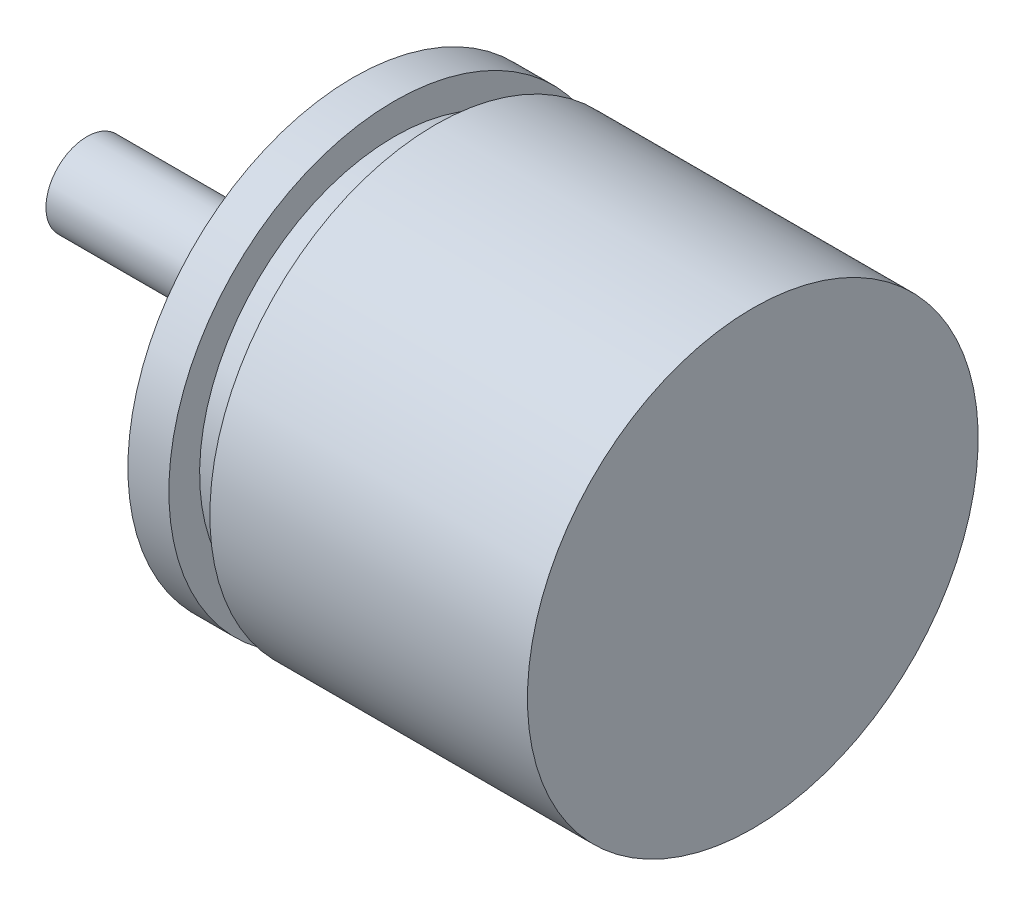
from build123d import *
from build123d.topology import SkipClean

# Parameters (mm, degrees)
CUT_EXTRUDE_START   = -10
CUT_EXTRUDE_1_DEPTH = 10
SKETCH_3_R          = 1
CUT_EXTRUDE_2_DEPTH = 5
THREAD_1_PITCH      = 0.4
THREAD_2_PITCH      = 0.4
THREAD_3_PITCH      = 0.4


with BuildPart() as part:
    # Sketch 1 → 旋转1 (revolve)
    with BuildSketch(Plane.XY):
        Polygon((-15.5, 11), (0, 11), (0, 0), (-32.5, 0), (-32.5, 2), (-20.5, 2), (-20.5, 4), (-19.5, 4), (-19.5, 11), (-17.5, 11), (-17.5, 9.5), (-15.5, 9.5), align=None)
    revolve(axis=Axis((12.953613798, 0, 0), (-1, 0, 0)))

    # Sketch 2 → 切除-拉伸1 (cut)
    with BuildSketch(Plane.ZY.offset(32.5).offset(CUT_EXTRUDE_START)):
        with BuildLine():
            Line((1.2, -1.6), (-1.2, -1.6))
            ThreePointArc((-1.2, -1.6), (0, -2), (1.2, -1.6))
        make_face()
    extrude(amount=CUT_EXTRUDE_1_DEPTH, mode=Mode.SUBTRACT)

    # Sketch 3 → 切除-拉伸2 (cut)
    with BuildSketch(Plane.ZY.offset(19.5)):
        with Locations(Location((-7.5, 0, 0), (0, 0, 270))):
            Circle(SKETCH_3_R)
        with Locations(Location((3.75, 6.495190528, 0), (0, 0, 270))):
            Circle(SKETCH_3_R)
        with Locations(Location((3.75, -6.495190528, 0), (0, 0, 270))):
            Circle(SKETCH_3_R)
    extrude(amount=-CUT_EXTRUDE_2_DEPTH, mode=Mode.SUBTRACT)

    # 螺纹线1: the profile of Sketch 1 2 profile screwed along a right-hand helix of 12.5 turns, 6 arcs to a turn; built about Z, then put on its axis
    with SkipClean():  # the faces are left unmerged after this step: merging them gives an invalid solid
        thread_1_z = Axis((0, 0, 0), (0, 0, 1))
        thread_1_corners = [(0.9997, 0, -0.000173205), (1.21650635, 0, 0.124999999), (1.21650635, 0, 0.174999999), (0.9997, 0, 0.300173204)]
        with BuildLine(mode=Mode.PRIVATE) as thread_1_profile:
            Line(thread_1_corners[0], thread_1_corners[1])
            Line(thread_1_corners[1], thread_1_corners[2])
            Line(thread_1_corners[2], thread_1_corners[3])
            Line(thread_1_corners[3], thread_1_corners[0])
        thread_1_cap = Face(thread_1_profile.wire())
        thread_1_turn_angles = [0, 30, 60, 90, 120, 150, 180, 210, 240, 270, 300, 330, 360]
        thread_1_turn_weights = [1, 0.8660254037844387, 1, 0.8660254037844387, 1, 0.8660254037844387, 1, 0.8660254037844387, 1, 0.8660254037844387, 1, 0.8660254037844387, 1]
        thread_1_turn_rails = [Edge.make_bspline([Vector(p[0], p[1], 0).rotate(thread_1_z, thread_1_turn_angles[k]) / thread_1_turn_weights[k] + Vector(0, 0, p[2] + THREAD_1_PITCH * thread_1_turn_angles[k] / 360) for k in range(13)], [0, 0, 0, 1, 1, 2, 2, 3, 3, 4, 4, 5, 5, 6, 6, 6], 2, thread_1_turn_weights) for p in thread_1_corners]
        thread_1_turn_sides = [Face.make_surface_from_curves(thread_1_turn_rails[p[0]], thread_1_turn_rails[p[1]]) for p in [(0, 1), (1, 2), (2, 3), (3, 0)]]
        thread_1_last_angles = [4320, 4350, 4380, 4410, 4440, 4470, 4500]
        thread_1_last_weights = [1, 0.8660254037844387, 1, 0.8660254037844387, 1, 0.8660254037844387, 1]
        thread_1_last_rails = [Edge.make_bspline([Vector(p[0], p[1], 0).rotate(thread_1_z, thread_1_last_angles[k]) / thread_1_last_weights[k] + Vector(0, 0, p[2] + THREAD_1_PITCH * thread_1_last_angles[k] / 360) for k in range(7)], [0, 0, 0, 1, 1, 2, 2, 3, 3, 3], 2, thread_1_last_weights) for p in thread_1_corners]
        thread_1_last_sides = [Face.make_surface_from_curves(thread_1_last_rails[p[0]], thread_1_last_rails[p[1]]) for p in [(0, 1), (1, 2), (2, 3), (3, 0)]]
        thread_1 = Plane(origin=(-19.5, 0, -7.5), x_dir=(0, 0, -1), z_dir=(1, 0, 0)) * Solid(Shell([*[p.moved(Location((0, 0, THREAD_1_PITCH * i))) for i in range(12) for p in thread_1_turn_sides], *thread_1_last_sides, thread_1_cap, thread_1_cap.rotate(thread_1_z, 4500).moved(Location((0, 0, THREAD_1_PITCH * 4500 / 360)))]))
        add(thread_1, mode=Mode.SUBTRACT)

    # 螺纹线2: the profile of Sketch 2 2 profile screwed along a right-hand helix of 12.5 turns, 6 arcs to a turn; built about Z, then put on its axis
    with SkipClean():  # the faces are left unmerged after this step: merging them gives an invalid solid
        thread_2_z = Axis((0, 0, 0), (0, 0, 1))
        thread_2_corners = [(0.9997, 0, -0.000173205), (1.21650635, 0, 0.124999999), (1.21650635, 0, 0.174999999), (0.9997, 0, 0.300173204)]
        with BuildLine(mode=Mode.PRIVATE) as thread_2_profile:
            Line(thread_2_corners[0], thread_2_corners[1])
            Line(thread_2_corners[1], thread_2_corners[2])
            Line(thread_2_corners[2], thread_2_corners[3])
            Line(thread_2_corners[3], thread_2_corners[0])
        thread_2_cap = Face(thread_2_profile.wire())
        thread_2_turn_angles = [0, 30, 60, 90, 120, 150, 180, 210, 240, 270, 300, 330, 360]
        thread_2_turn_weights = [1, 0.8660254037844387, 1, 0.8660254037844387, 1, 0.8660254037844387, 1, 0.8660254037844387, 1, 0.8660254037844387, 1, 0.8660254037844387, 1]
        thread_2_turn_rails = [Edge.make_bspline([Vector(p[0], p[1], 0).rotate(thread_2_z, thread_2_turn_angles[k]) / thread_2_turn_weights[k] + Vector(0, 0, p[2] + THREAD_2_PITCH * thread_2_turn_angles[k] / 360) for k in range(13)], [0, 0, 0, 1, 1, 2, 2, 3, 3, 4, 4, 5, 5, 6, 6, 6], 2, thread_2_turn_weights) for p in thread_2_corners]
        thread_2_turn_sides = [Face.make_surface_from_curves(thread_2_turn_rails[p[0]], thread_2_turn_rails[p[1]]) for p in [(0, 1), (1, 2), (2, 3), (3, 0)]]
        thread_2_last_angles = [4320, 4350, 4380, 4410, 4440, 4470, 4500]
        thread_2_last_weights = [1, 0.8660254037844387, 1, 0.8660254037844387, 1, 0.8660254037844387, 1]
        thread_2_last_rails = [Edge.make_bspline([Vector(p[0], p[1], 0).rotate(thread_2_z, thread_2_last_angles[k]) / thread_2_last_weights[k] + Vector(0, 0, p[2] + THREAD_2_PITCH * thread_2_last_angles[k] / 360) for k in range(7)], [0, 0, 0, 1, 1, 2, 2, 3, 3, 3], 2, thread_2_last_weights) for p in thread_2_corners]
        thread_2_last_sides = [Face.make_surface_from_curves(thread_2_last_rails[p[0]], thread_2_last_rails[p[1]]) for p in [(0, 1), (1, 2), (2, 3), (3, 0)]]
        thread_2 = Plane(origin=(-19.5, 6.495190528, 3.75), x_dir=(0, 0, -1), z_dir=(1, 0, 0)) * Solid(Shell([*[p.moved(Location((0, 0, THREAD_2_PITCH * i))) for i in range(12) for p in thread_2_turn_sides], *thread_2_last_sides, thread_2_cap, thread_2_cap.rotate(thread_2_z, 4500).moved(Location((0, 0, THREAD_2_PITCH * 4500 / 360)))]))
        add(thread_2, mode=Mode.SUBTRACT)

    # 螺纹线3: the profile of Sketch 3 2 profile screwed along a right-hand helix of 12.5 turns, 6 arcs to a turn; built about Z, then put on its axis
    with SkipClean():  # the faces are left unmerged after this step: merging them gives an invalid solid
        thread_3_z = Axis((0, 0, 0), (0, 0, 1))
        thread_3_corners = [(0.9997, 0, -0.000173205), (1.21650635, 0, 0.124999999), (1.21650635, 0, 0.174999999), (0.9997, 0, 0.300173204)]
        with BuildLine(mode=Mode.PRIVATE) as thread_3_profile:
            Line(thread_3_corners[0], thread_3_corners[1])
            Line(thread_3_corners[1], thread_3_corners[2])
            Line(thread_3_corners[2], thread_3_corners[3])
            Line(thread_3_corners[3], thread_3_corners[0])
        thread_3_cap = Face(thread_3_profile.wire())
        thread_3_turn_angles = [0, 30, 60, 90, 120, 150, 180, 210, 240, 270, 300, 330, 360]
        thread_3_turn_weights = [1, 0.8660254037844387, 1, 0.8660254037844387, 1, 0.8660254037844387, 1, 0.8660254037844387, 1, 0.8660254037844387, 1, 0.8660254037844387, 1]
        thread_3_turn_rails = [Edge.make_bspline([Vector(p[0], p[1], 0).rotate(thread_3_z, thread_3_turn_angles[k]) / thread_3_turn_weights[k] + Vector(0, 0, p[2] + THREAD_3_PITCH * thread_3_turn_angles[k] / 360) for k in range(13)], [0, 0, 0, 1, 1, 2, 2, 3, 3, 4, 4, 5, 5, 6, 6, 6], 2, thread_3_turn_weights) for p in thread_3_corners]
        thread_3_turn_sides = [Face.make_surface_from_curves(thread_3_turn_rails[p[0]], thread_3_turn_rails[p[1]]) for p in [(0, 1), (1, 2), (2, 3), (3, 0)]]
        thread_3_last_angles = [4320, 4350, 4380, 4410, 4440, 4470, 4500]
        thread_3_last_weights = [1, 0.8660254037844387, 1, 0.8660254037844387, 1, 0.8660254037844387, 1]
        thread_3_last_rails = [Edge.make_bspline([Vector(p[0], p[1], 0).rotate(thread_3_z, thread_3_last_angles[k]) / thread_3_last_weights[k] + Vector(0, 0, p[2] + THREAD_3_PITCH * thread_3_last_angles[k] / 360) for k in range(7)], [0, 0, 0, 1, 1, 2, 2, 3, 3, 3], 2, thread_3_last_weights) for p in thread_3_corners]
        thread_3_last_sides = [Face.make_surface_from_curves(thread_3_last_rails[p[0]], thread_3_last_rails[p[1]]) for p in [(0, 1), (1, 2), (2, 3), (3, 0)]]
        thread_3 = Plane(origin=(-19.5, -6.495190528, 3.75), x_dir=(0, 0, -1), z_dir=(1, 0, 0)) * Solid(Shell([*[p.moved(Location((0, 0, THREAD_3_PITCH * i))) for i in range(12) for p in thread_3_turn_sides], *thread_3_last_sides, thread_3_cap, thread_3_cap.rotate(thread_3_z, 4500).moved(Location((0, 0, THREAD_3_PITCH * 4500 / 360)))]))
        add(thread_3, mode=Mode.SUBTRACT)


solid = part.part
